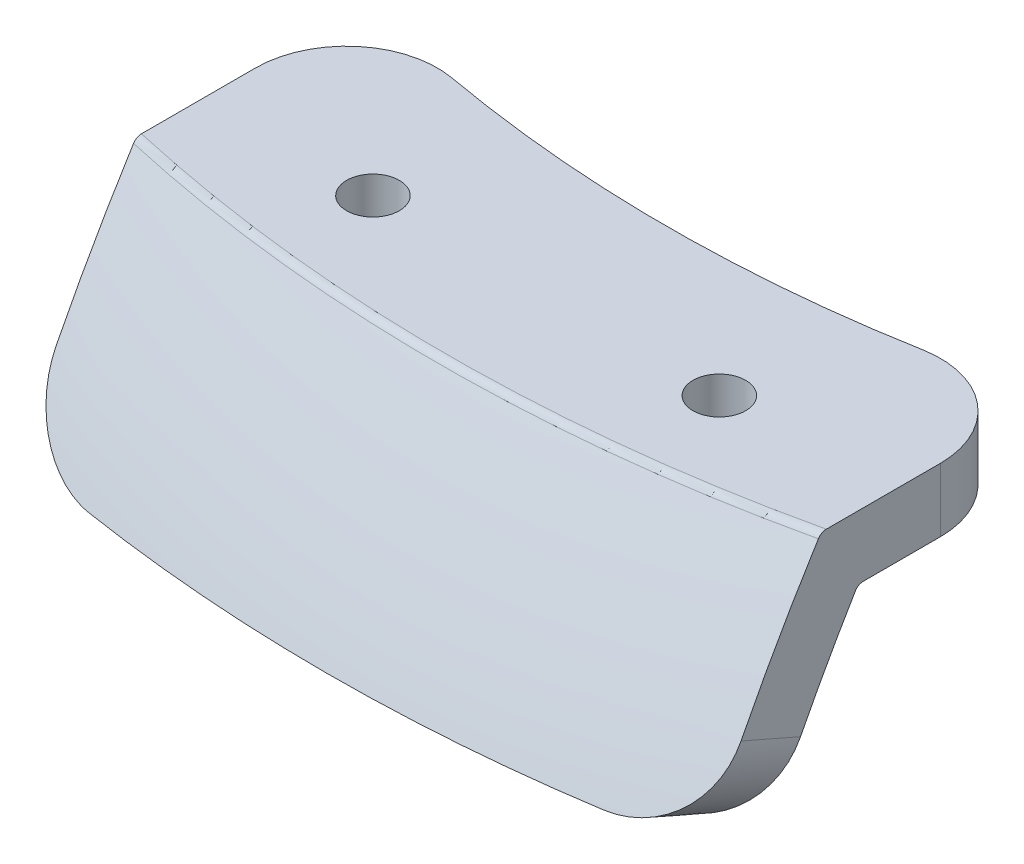
from build123d import *

# Parameters (mm, degrees)
REVOLVE1_ANGLE      = 30
SKETCH5_OUTSIDE_W   = 118.116
SKETCH5_OUTSIDE_H   = 65.786
SKETCH5_OUTSIDE_W_2 = 75.329921726
SKETCH5_OUTSIDE_H_2 = 42.362110511
CUT_EXTRUDE2_DEPTH  = 272.294488106
FILLET1_R           = 10
FILLET2_R           = 1
SKETCH6_R           = 2.9
CUT_EXTRUDE3_DEPTH  = 189.665890372


with BuildPart() as part:
    # Sketch1 → Revolve1 (revolve, symmetric)
    with BuildSketch(Plane(origin=(0, 0, 0), x_dir=(0, 0, -1), z_dir=(1, 0, 0))) as revolve1_sk:
        with BuildLine():
            Line((-182.929658118, 170.799710184), (-176.527920301, 167.968146495))
            ThreePointArc((-176.527920301, 167.968146495), (-171.7595902, 177.96327834), (-166.425900574, 187.668503093))
            Line((-166.425900574, 187.668503093), (-145.526233777, 187.668503093))
            Line((-145.526233777, 187.668503093), (-145.526233777, 194.668503093))
            Line((-145.526233777, 194.668503093), (-170.38485915, 194.668503093))
            ThreePointArc((-170.38485915, 194.668503093), (-177.059924452, 182.945737019), (-182.929658118, 170.799710184))
        make_face()
    revolve(axis=Axis((0, 0, 0), (0, 1, 0)), revolution_arc=REVOLVE1_ANGLE / 2)
    revolve(revolve1_sk.sketch, axis=Axis((0, 0, 0), (0, -1, 0)), revolution_arc=REVOLVE1_ANGLE / 2)

    # Sketch4 → Cut-Revolve1 (revolve, cut)
    with BuildSketch(Plane(origin=(0, 71.361243959, -36.360369904), x_dir=(0, 0.45399049973954464, 0.8910065241883691), z_dir=(0, -0.8910065241883691, 0.45399049973954464))):
        Polygon((219.749406501, 20.731311642), (239.017694648, 22.41706842), (239.148428262, 20.922776373), (219.880140115, 19.237019595), align=None)
    cut_revolve1 = revolve(axis=Axis((-19.237019595, 171.184738652, 159.554269478), (-0.08715574274765822, 0.4522629288245578, 0.8876159753616071)), mode=Mode.SUBTRACT)

    # Mirror1: Cut-Revolve1 across plane
    add(cut_revolve1.mirror(Plane(origin=(0, 0, 0), x_dir=(0, 0, 1), z_dir=(1, 0, 0))), mode=Mode.SUBTRACT)

    # Sketch5 outside → Cut-Extrude2 (cut, through all)
    with BuildSketch(Plane(origin=(0, 0, 0), x_dir=(1, 0, 0), z_dir=(0, 1, 0))):
        with Locations((0, -161.749)):
            Rectangle(SKETCH5_OUTSIDE_W, SKETCH5_OUTSIDE_H)
        with Locations((0, -161.748602863)):
            Rectangle(SKETCH5_OUTSIDE_W_2, SKETCH5_OUTSIDE_H_2, mode=Mode.SUBTRACT)
    extrude(amount=CUT_EXTRUDE2_DEPTH, mode=Mode.SUBTRACT)

    # Fillet1
    fillet1_edges = [part.edges().sort_by_distance(p)[0] for p in [
        (-37.664960863, 191.168503093, 140.567547607),
        (37.664960863, 191.168503093, 140.567547607),
        (-37.664960863, 169.38344031, 175.736711543),
        (37.664960863, 169.38344031, 175.736711543),
    ]]
    fillet(fillet1_edges, radius=FILLET1_R)

    # Fillet2
    fillet2_edges = [part.edges().sort_by_distance(p)[0] for p in [
        (0, 194.668503093, 170.38485915),
        (0, 187.668503093, 166.425900574),
    ]]
    fillet(fillet2_edges, radius=FILLET2_R)

    # Sketch6 → Cut-Extrude3 (cut, through all)
    with BuildSketch(Plane(origin=(0, 194.668503093, 0), x_dir=(1, 0, 0), z_dir=(0, 1, 0))):
        with Locations((19.05, -158.75)):
            Circle(SKETCH6_R)
        with Locations((-19.05, -158.75)):
            Circle(SKETCH6_R)
    extrude(amount=-CUT_EXTRUDE3_DEPTH, mode=Mode.SUBTRACT)


solid = part.part
